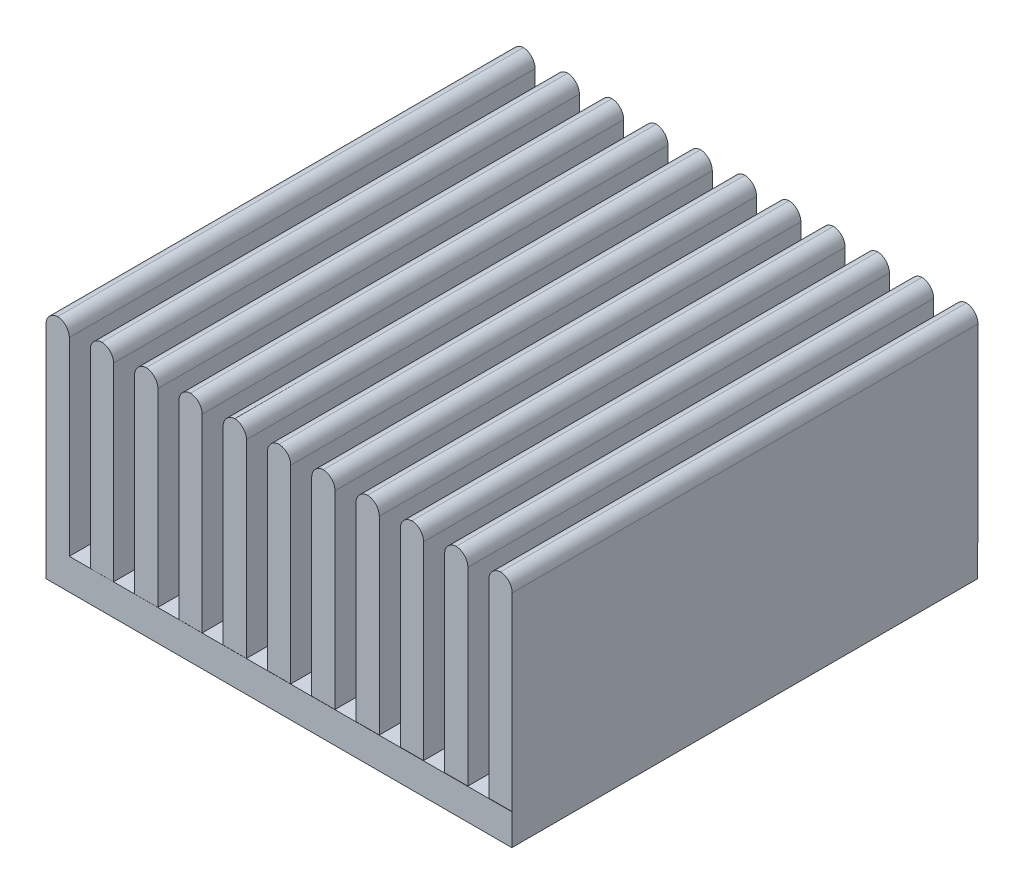
from build123d import *

# Parameters (mm, degrees)
SKETCH1_W           = 38.1
SKETCH1_H           = 38.1
BOSS_EXTRUDE1_DEPTH = 2.54
SKETCH2_W           = 1.905
SKETCH2_H           = 38.1
BOSS_EXTRUDE2_DEPTH = 16.51
FILLET3_R           = 1.016


with BuildPart() as part:
    # Sketch1 → Boss-Extrude1 (new body)
    with BuildSketch(Plane(origin=(0, 0, 0), x_dir=(1, 0, 0), z_dir=(0, 1, 0))):
        Rectangle(SKETCH1_W, SKETCH1_H)
    extrude(amount=BOSS_EXTRUDE1_DEPTH)

    # Sketch2 → Boss-Extrude2 (add)
    with BuildSketch(Plane(origin=(0, 2.54, 0), x_dir=(1, 0, 0), z_dir=(0, 1, 0))):
        with Locations((-18.0975, 0)):
            Rectangle(SKETCH2_W, SKETCH2_H)
        with Locations((-14.478, 0.002613699)):
            Rectangle(SKETCH2_W, SKETCH2_H)
        with Locations((-10.8585, 0.005227397)):
            Rectangle(SKETCH2_W, SKETCH2_H)
        with Locations((-7.239, 0.007841096)):
            Rectangle(SKETCH2_W, SKETCH2_H)
        with Locations((-3.6195, 0.010454795)):
            Rectangle(SKETCH2_W, SKETCH2_H)
        with Locations((0, 0.013068494)):
            Rectangle(SKETCH2_W, SKETCH2_H)
        with Locations((3.6195, 0.015682192)):
            Rectangle(SKETCH2_W, SKETCH2_H)
        with Locations((7.239, 0.018295891)):
            Rectangle(SKETCH2_W, SKETCH2_H)
        with Locations((10.8585, 0.02090959)):
            Rectangle(SKETCH2_W, SKETCH2_H)
        with Locations((14.478, 0.023523288)):
            Rectangle(SKETCH2_W, SKETCH2_H)
        with Locations((18.0975, 0.026136987)):
            Rectangle(SKETCH2_W, SKETCH2_H)
    extrude(amount=BOSS_EXTRUDE2_DEPTH)

    # Fillet3
    # the kernel refuses this fillet: 1.016 mm, written as the material it takes off along each edge
    with BuildSketch(Plane(origin=(-19.05, 19.05, 21.59), x_dir=(1, 0, 0), z_dir=(0, 0, -1)), Plane(origin=(17.145, 19.05, -21.616136987), x_dir=(0, -1, 0), z_dir=(0, 0, 1)), Plane(origin=(13.5255, 19.05, -21.613523288), x_dir=(0, -1, 0), z_dir=(0, 0, 1)), Plane(origin=(9.906, 19.05, -21.61090959), x_dir=(0, -1, 0), z_dir=(0, 0, 1)), Plane(origin=(6.2865, 19.05, -21.608295891), x_dir=(0, -1, 0), z_dir=(0, 0, 1)), Plane(origin=(2.667, 19.05, -21.605682192), x_dir=(0, -1, 0), z_dir=(0, 0, 1)), Plane(origin=(-0.9525, 19.05, -21.603068494), x_dir=(0, -1, 0), z_dir=(0, 0, 1)), Plane(origin=(-4.572, 19.05, -21.600454795), x_dir=(0, -1, 0), z_dir=(0, 0, 1)), Plane(origin=(-8.1915, 19.05, -21.597841096), x_dir=(0, -1, 0), z_dir=(0, 0, 1)), Plane(origin=(-11.811, 19.05, -21.595227397), x_dir=(0, -1, 0), z_dir=(0, 0, 1)), Plane(origin=(-15.4305, 19.05, -21.592613699), x_dir=(0, -1, 0), z_dir=(0, 0, 1))) as fillet3_piece_1:
        with BuildLine():
            CenterArc((FILLET3_R, FILLET3_R), FILLET3_R, 180, 90)
            Line((0, FILLET3_R), (0, 0))
            Line((0, 0), (FILLET3_R, 0))
        make_face()
    extrude(amount=43.18, mode=Mode.SUBTRACT)
    with BuildSketch(Plane(origin=(-17.145, 19.05, -21.59), x_dir=(0, -1, 0), z_dir=(0, 0, 1)), Plane(origin=(19.05, 19.05, 21.563863013), x_dir=(-1, 0, 0), z_dir=(0, 0, -1)), Plane(origin=(15.4305, 19.05, 21.566476712), x_dir=(-1, 0, 0), z_dir=(0, 0, -1)), Plane(origin=(11.811, 19.05, 21.56909041), x_dir=(-1, 0, 0), z_dir=(0, 0, -1)), Plane(origin=(8.1915, 19.05, 21.571704109), x_dir=(-1, 0, 0), z_dir=(0, 0, -1)), Plane(origin=(4.572, 19.05, 21.574317808), x_dir=(-1, 0, 0), z_dir=(0, 0, -1)), Plane(origin=(0.9525, 19.05, 21.576931506), x_dir=(-1, 0, 0), z_dir=(0, 0, -1)), Plane(origin=(-2.667, 19.05, 21.579545205), x_dir=(-1, 0, 0), z_dir=(0, 0, -1)), Plane(origin=(-6.2865, 19.05, 21.582158904), x_dir=(-1, 0, 0), z_dir=(0, 0, -1)), Plane(origin=(-9.906, 19.05, 21.584772603), x_dir=(-1, 0, 0), z_dir=(0, 0, -1)), Plane(origin=(-13.5255, 19.05, 21.587386301), x_dir=(-1, 0, 0), z_dir=(0, 0, -1))) as fillet3_piece_2:
        with BuildLine():
            CenterArc((FILLET3_R, -FILLET3_R), FILLET3_R, 90, 90)
            Line((0, -FILLET3_R), (0, 0))
            Line((0, 0), (FILLET3_R, 0))
        make_face()
    extrude(amount=43.18, mode=Mode.SUBTRACT)


solid = part.part
